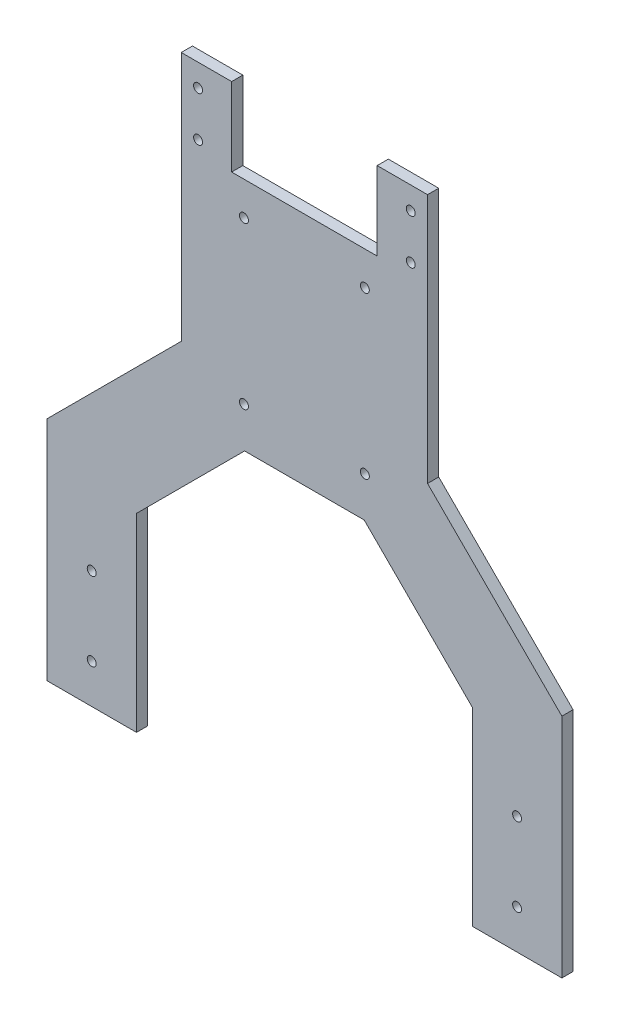
from build123d import *

# Parameters (mm, degrees)
SKETCH1_R           = 2
BOSS_EXTRUDE1_DEPTH = 5
SKETCH2_R           = 2
BOSS_EXTRUDE2_DEPTH = 5


with BuildPart() as part:
    # Sketch1 → Boss-Extrude1 (new body)
    with BuildSketch(Plane.XY):
        Polygon((-32.5, 70), (-55, 70), (-55, -70), (55, -70), (55, 70), (32.5, 70), (32.5, 35), (-32.5, 35), align=None)
        with Locations((-27, -52)):
            Circle(SKETCH1_R, mode=Mode.SUBTRACT)
        with Locations((27, -52)):
            Circle(SKETCH1_R, mode=Mode.SUBTRACT)
        with Locations((-27, 20)):
            Circle(SKETCH1_R, mode=Mode.SUBTRACT)
        with Locations((-47.5, 40)):
            Circle(SKETCH1_R, mode=Mode.SUBTRACT)
        with Locations((-47.5, 60)):
            Circle(SKETCH1_R, mode=Mode.SUBTRACT)
        with Locations((27, 20)):
            Circle(SKETCH1_R, mode=Mode.SUBTRACT)
        with Locations((47.5, 40)):
            Circle(SKETCH1_R, mode=Mode.SUBTRACT)
        with Locations((47.5, 60)):
            Circle(SKETCH1_R, mode=Mode.SUBTRACT)
    extrude(amount=BOSS_EXTRUDE1_DEPTH)

    # Sketch2 → Boss-Extrude2 (add)
    with BuildSketch(Plane.XY):
        Polygon((-26.715726767, -70), (-55, -41.715726767), (-115, -101.715728753), (-115, -203), (-75, -203), (-75, -118.284271635), align=None)
        with Locations((-95, -185.5)):
            Circle(SKETCH2_R, mode=Mode.SUBTRACT)
        with Locations((-95, -150.5)):
            Circle(SKETCH2_R, mode=Mode.SUBTRACT)
    boss_extrude2 = extrude(amount=BOSS_EXTRUDE2_DEPTH)

    # Mirror1: Boss-Extrude2 across plane
    add(boss_extrude2.mirror(Plane(origin=(0, 0, 0), x_dir=(0, 0, 1), z_dir=(1, 0, 0))))


solid = part.part
